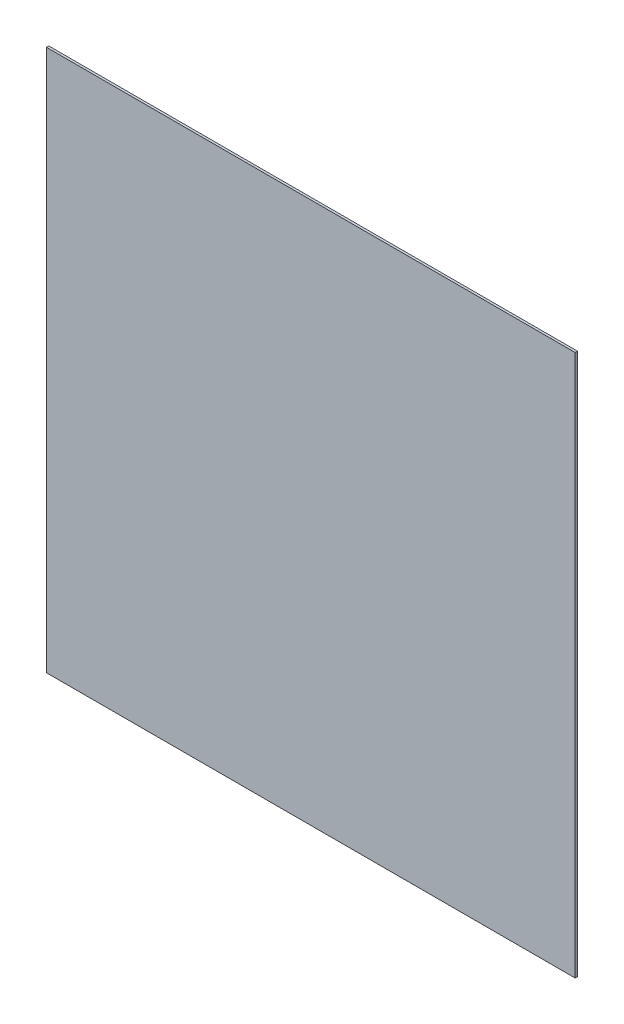
from build123d import *

# Parameters (mm, degrees)
SKETCH1_W          = 340.5
SKETCH1_H          = 349
BASE_FLANGE1_DEPTH = 1.5


# Sheet-metal steps are written as plain solids
with BuildPart() as part:
    # Sketch1 → Base-Flange1 (new body)
    with BuildSketch(Plane.XY):
        Rectangle(SKETCH1_W, SKETCH1_H)
    extrude(amount=-BASE_FLANGE1_DEPTH)


solid = part.part
